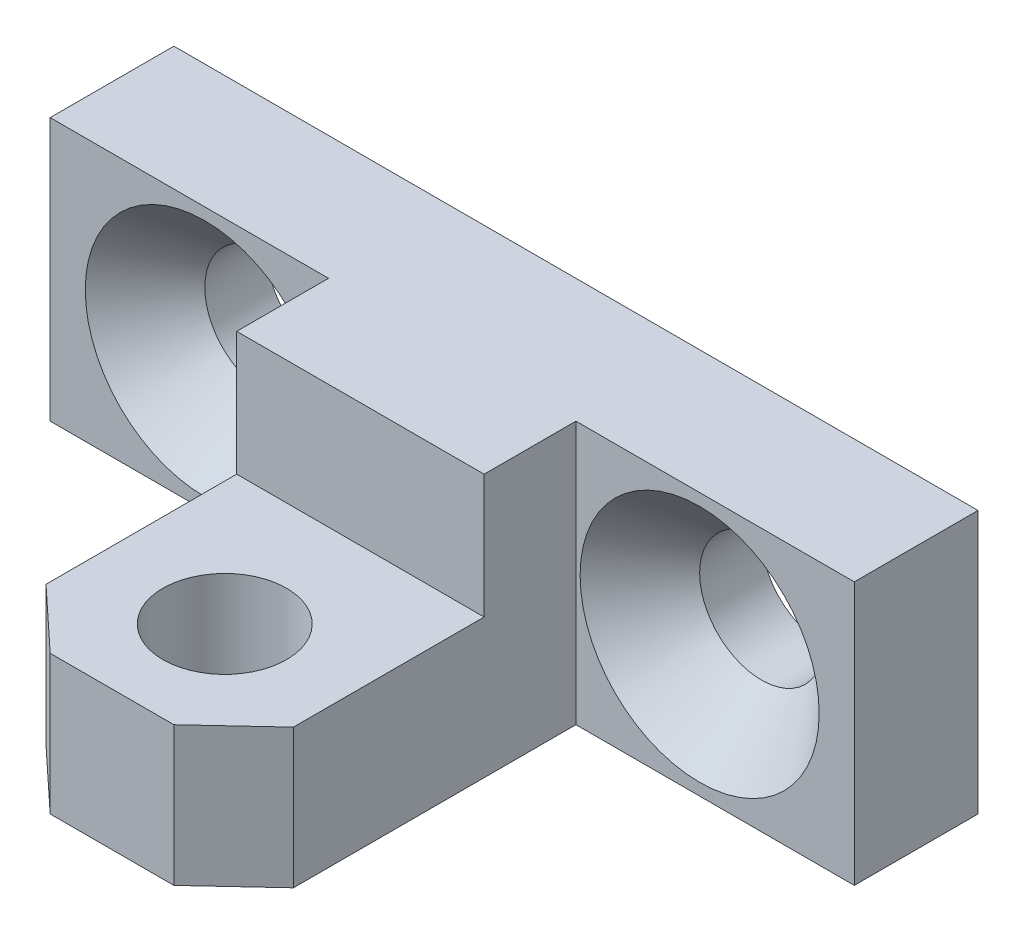
from build123d import *
from OCP.BRepFilletAPI import BRepFilletAPI_MakeChamfer

# Parameters (mm, degrees)
SKETCH_1_W            = 26
SKETCH_1_H            = 8.5
EXTRUDE_1_DEPTH       = 15
SKETCH_2_W            = 9
SKETCH_2_H            = 17.151512959
CUT_EXTRUDE_2_DEPTH   = 20
CHAMFER_1_SIZE        = 2
CHAMFER_1_SIZE2       = 1.865030172
SKETCH_3_R            = 2
CUT_EXTRUDE_1_DEPTH   = 32.19695498
CHAMFER_2_SIZE        = 2
CHAMFER_2_SIZE2       = 1.865030172
SKETCH_4_W            = 11.3471837
SKETCH_4_H            = 8.882896331
CUT_EXTRUDE_2_2_DEPTH = 4
SKETCH_5_R            = 2
CUT_EXTRUDE_3_DEPTH   = 31.352100422


with BuildPart() as part:
    # Эскиз1 → Вытянуть1 (new body)
    with BuildSketch(Plane.XY):
        with Locations((13, -4.25)):
            Rectangle(SKETCH_1_W, SKETCH_1_H)
    extrude(amount=EXTRUDE_1_DEPTH)

    # Эскиз2 → Cut-Extrude 2 (cut)
    with BuildSketch(Plane(origin=(0, 0, 0), x_dir=(1, 0, 0), z_dir=(0, 1, 0))):
        with Locations((4.5, -12.57575648)):
            Rectangle(SKETCH_2_W, SKETCH_2_H)
        with Locations((21.5, -12.57575648)):
            Rectangle(SKETCH_2_W, SKETCH_2_H)
    extrude(amount=-CUT_EXTRUDE_2_DEPTH, mode=Mode.SUBTRACT)

    # Фаска1
    chamfer_1_edges = [part.edges().sort_by_distance(p)[0] for p in [
        (17, -4.25, 15),
        (9, -4.25, 15),
    ]]
    chamfer_1_side = [part.faces().sort_by_distance(p)[0] for p in [
        (13, -4.25, 15),
    ]]
    chamfer(chamfer_1_edges, length=CHAMFER_1_SIZE, length2=CHAMFER_1_SIZE2, reference=chamfer_1_side[0])

    # Эскиз3 → Вырез-Вытянуть1 (cut, through all)
    with BuildSketch(Plane(origin=(0, 0, 0), x_dir=(-1, 0, 0), z_dir=(0, 0, -1))):
        with Locations((-21, -4.250000001)):
            Circle(SKETCH_3_R)
        with Locations((-5, -4.251501777)):
            Circle(SKETCH_3_R)
    extrude(amount=-CUT_EXTRUDE_1_DEPTH, mode=Mode.SUBTRACT)

    # Фаска2: one chamfer whose edges measure the first distance from different faces: ONE call of the kernel's chamfer builder (chamfer() names one face for all edges)
    chamfer_2_edges_1 = [part.edges().sort_by_distance(p)[0] for p in [
        (23, -4.250000001, 4),
    ]]
    chamfer_2_side_1 = [part.faces().sort_by_distance(p)[0] for p in [
        (23, -4.250000001, 2),
    ]]
    chamfer_2_edges_2 = [part.edges().sort_by_distance(p)[0] for p in [
        (7, -4.251501777, 4),
    ]]
    chamfer_2_side_2 = [part.faces().sort_by_distance(p)[0] for p in [
        (7, -4.251501777, 2),
    ]]
    chamfer_2 = BRepFilletAPI_MakeChamfer(part.part.solid().wrapped)
    for e in chamfer_2_edges_1:
        chamfer_2.Add(CHAMFER_2_SIZE, CHAMFER_2_SIZE2, e.wrapped, chamfer_2_side_1[0].wrapped)  # the first distance lies on this face
    for e in chamfer_2_edges_2:
        chamfer_2.Add(CHAMFER_2_SIZE, CHAMFER_2_SIZE2, e.wrapped, chamfer_2_side_2[0].wrapped)  # the first distance lies on this face
    add(Compound.cast(chamfer_2.Shape()), mode=Mode.REPLACE)

    # Эскиз4 → Cut-Extrude 2 2 (cut)
    with BuildSketch(Plane(origin=(0, 0, 0), x_dir=(1, 0, 0), z_dir=(0, 1, 0))):
        with Locations((13.06322118, -11.410294164)):
            Rectangle(SKETCH_4_W, SKETCH_4_H)
    extrude(amount=-CUT_EXTRUDE_2_2_DEPTH, mode=Mode.SUBTRACT)

    # Эскиз5 → Вырез-Вытянуть3 (cut, through all)
    with BuildSketch(Plane(origin=(0, -4, 0), x_dir=(1, 0, 0), z_dir=(0, 1, 0))):
        with Locations((13, -11.355717768)):
            Circle(SKETCH_5_R)
    extrude(amount=-CUT_EXTRUDE_3_DEPTH, mode=Mode.SUBTRACT)


solid = part.part
